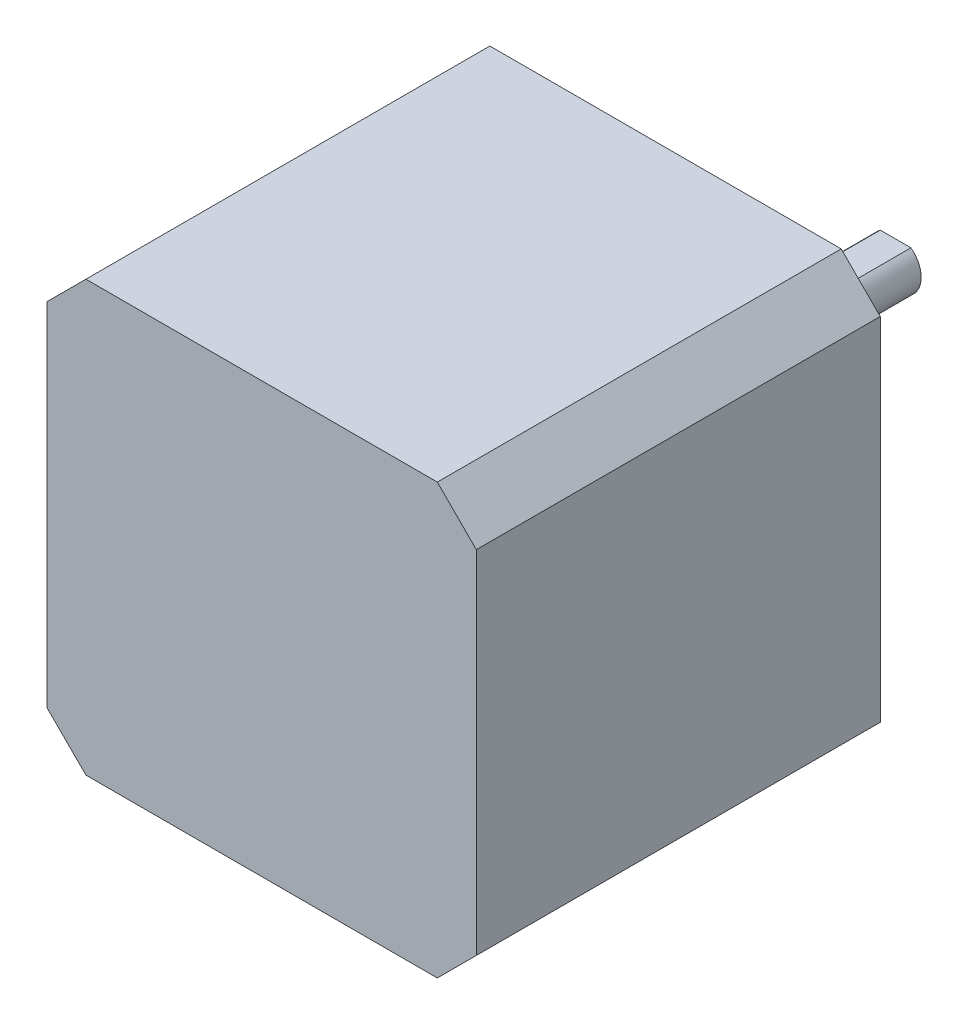
from build123d import *

# Parameters (mm, degrees)
EXTRUDE_1_DEPTH     = 39.5
SKETCH_2_R          = 11
EXTRUDE_2_DEPTH     = 2
SKETCH_3_R          = 2.5
EXTRUDE_3_DEPTH     = 20.5
SKETCH_4_R          = 1.5
CUT_EXTRUDE_1_DEPTH = 5
CUT_EXTRUDE_START   = -18
CUT_EXTRUDE_2_DEPTH = 18


with BuildPart() as part:
    # 草图1 → 凸台-拉伸1 (new body)
    with BuildSketch(Plane.XY):
        Polygon((-17.183766184, 21), (17.183766184, 21), (21, 17.183766184), (21, -17.183766184), (17.183766184, -21), (-17.183766184, -21), (-21, -17.183766184), (-21, 17.183766184), align=None)
    extrude(amount=EXTRUDE_1_DEPTH)

    # 草图2 → 凸台-拉伸2 (add)
    with BuildSketch(Plane(origin=(0, 0, 0), x_dir=(-1, 0, 0), z_dir=(0, 0, -1))):
        Circle(SKETCH_2_R)
    extrude(amount=EXTRUDE_2_DEPTH)

    # 草图3 → 凸台-拉伸3 (add)
    with BuildSketch(Plane(origin=(0, 0, -2), x_dir=(-1, 0, 0), z_dir=(0, 0, -1))):
        Circle(SKETCH_3_R)
    extrude(amount=EXTRUDE_3_DEPTH)

    # 草图4 → 切除-拉伸1 (cut)
    with BuildSketch(Plane(origin=(0, 0, 0), x_dir=(-1, 0, 0), z_dir=(0, 0, -1))):
        with Locations((-15.5, -15.5)):
            Circle(SKETCH_4_R)
        with Locations((-15.5, 15.5)):
            Circle(SKETCH_4_R)
        with Locations((15.5, 15.5)):
            Circle(SKETCH_4_R)
        with Locations((15.5, -15.5)):
            Circle(SKETCH_4_R)
    extrude(amount=-CUT_EXTRUDE_1_DEPTH, mode=Mode.SUBTRACT)

    # 草图5 → 切除-拉伸2 (cut)
    with BuildSketch(Plane(origin=(0, 0, -22.5), x_dir=(-1, 0, 0), z_dir=(0, 0, -1)).offset(CUT_EXTRUDE_START)):
        with BuildLine():
            Line((1.5, 2), (-1.5, 2))
            ThreePointArc((-1.5, 2), (0, 2.5), (1.5, 2))
        make_face()
    extrude(amount=CUT_EXTRUDE_2_DEPTH, mode=Mode.SUBTRACT)


solid = part.part
